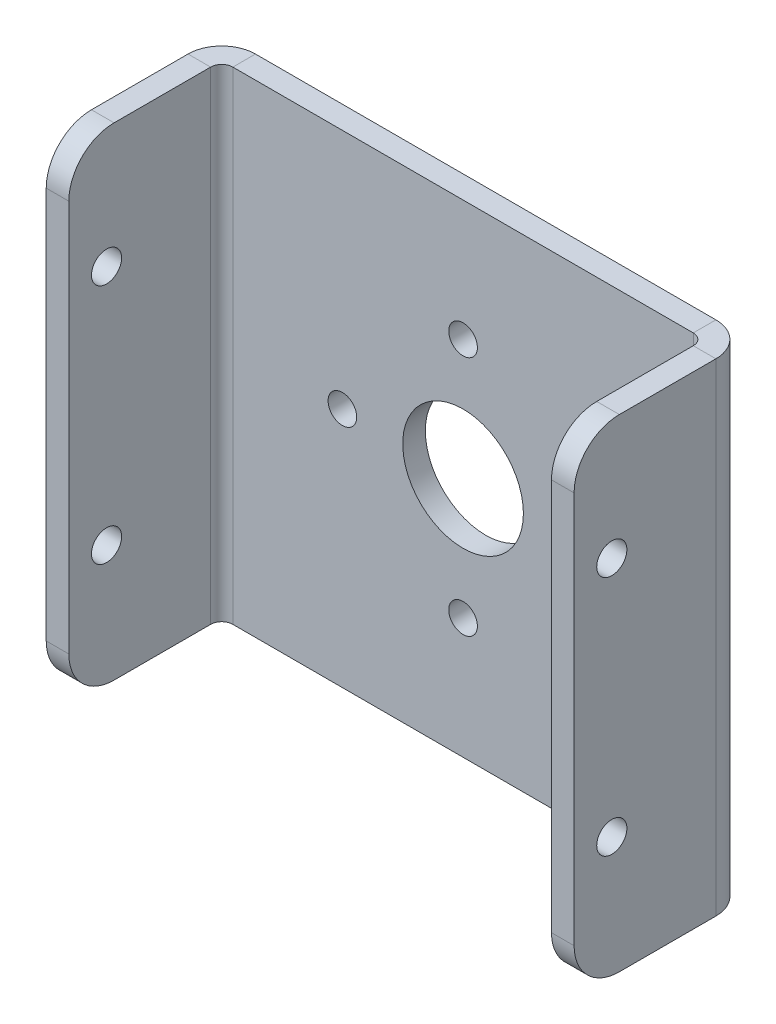
from build123d import *

# Parameters (mm, degrees)
SM_BASE_FLANGE_1_DEPTH = 1.5
OTHER_START            = -16
OTHER_1_DEPTH          = 32
OTHER_1_2_DEPTH        = 32
OTHER_START_2          = -18
OTHER_1_3_DEPTH        = 36
SKETCH_7_R             = 1
CUT_EXTRUDE_1_DEPTH    = 40.796735326
SKETCH_8_R             = 4
SKETCH_8_R_2           = 0.95
CUT_EXTRUDE_2_DEPTH    = 10


with BuildPart() as part:
    # 基体-法兰1: sheet metal written as solids
    # Sketch 1 → 基体-法兰1 (new body)
    with BuildSketch(Plane.XY):
        with BuildLine():
            Line((-24, -16), (24, -16))
            ThreePointArc((24, -16), (26.121320344, -15.121320344), (27, -13))
            Line((27, -13), (27, 13))
            ThreePointArc((27, 13), (26.121320344, 15.121320344), (24, 16))
            Line((24, 16), (-24, 16))
            ThreePointArc((-24, 16), (-26.121320344, 15.121320344), (-27, 13))
            Line((-27, 13), (-27, -13))
            ThreePointArc((-27, -13), (-26.121320344, -15.121320344), (-24, -16))
        make_face()
    extrude(amount=-SM_BASE_FLANGE_1_DEPTH)

    # Other 1: read off the stored shape, not the designer's step
    # Other 1 outline → Other 1 (cut)
    with BuildSketch(Plane(origin=(0, 0, 0), x_dir=(1, 0, 0), z_dir=(0, 1, 0)).offset(OTHER_START)):
        with BuildLine():
            ThreePointArc((-17.375223856, 0), (-16.558564082, 1.086838938), (-15.2634, 1.5))
            Line((-15.2634, 1.5), (-27, 1.5))
            Line((-27, 1.5), (-27, 0))
            Line((-27, 0), (-17.375223856, 0))
        make_face()
        with BuildLine():
            Line((27, 1.5), (15.2634, 1.5))
            ThreePointArc((15.2634, 1.5), (16.558564082, 1.086838938), (17.375223856, 0))
            Line((17.375223856, 0), (27, 0))
            Line((27, 0), (27, 1.5))
        make_face()
    extrude(amount=OTHER_1_DEPTH, mode=Mode.SUBTRACT)

    # Other 1 2 outline → Other 1 2 (add)
    with BuildSketch(Plane(origin=(0, 0, 0), x_dir=(1, 0, 0), z_dir=(0, 1, 0)).offset(OTHER_START)):
        with BuildLine():
            Line((-15.2634, 0), (-17.375223856, 0))
            ThreePointArc((-17.375223856, 0), (-17.468585343, -0.363053267), (-17.5, -0.7366))
            Line((-17.5, -0.7366), (-17.5, -10.138054181))
            Line((-17.5, -10.138054181), (-16, -10.138054181))
            Line((-16, -10.138054181), (-16, -0.7366))
            ThreePointArc((-16, -0.7366), (-15.784254855, -0.215745145), (-15.2634, 0))
        make_face()
        with BuildLine():
            ThreePointArc((17.5, -0.7366), (17.468585343, -0.363053267), (17.375223856, 0))
            Line((17.375223856, 0), (15.2634, 0))
            ThreePointArc((15.2634, 0), (15.784254855, -0.215745145), (16, -0.7366))
            Line((16, -0.7366), (16, -10.138054181))
            Line((16, -10.138054181), (17.5, -10.138054181))
            Line((17.5, -10.138054181), (17.5, -0.7366))
        make_face()
    extrude(amount=OTHER_1_2_DEPTH)

    # Other 1 3 outline → Other 1 3 (cut)
    with BuildSketch(Plane.YZ.offset(OTHER_START_2)):
        with BuildLine():
            ThreePointArc((-16, 7.138054181), (-15.121320344, 9.259374525), (-13, 10.138054181))
            Line((-13, 10.138054181), (-16, 10.138054181))
            Line((-16, 10.138054181), (-16, 7.138054181))
        make_face()
        with BuildLine():
            ThreePointArc((13, 10.138054181), (15.121320344, 9.259374525), (16, 7.138054181))
            Line((16, 7.138054181), (16, 10.138054181))
            Line((16, 10.138054181), (13, 10.138054181))
        make_face()
    extrude(amount=OTHER_1_3_DEPTH, mode=Mode.SUBTRACT)

    # 草图7 → 切除-拉伸1 (cut, through all)
    with BuildSketch(Plane.ZY.offset(17.5)):
        with Locations((7.638054181, 8)):
            Circle(SKETCH_7_R)
        with Locations((7.638054181, -8)):
            Circle(SKETCH_7_R)
    extrude(amount=-CUT_EXTRUDE_1_DEPTH, mode=Mode.SUBTRACT)

    # 草图8 → 切除-拉伸2 (cut)
    with BuildSketch(Plane.XY):
        Circle(SKETCH_8_R)
        with Locations((0, 8)):
            Circle(SKETCH_8_R_2)
        with Locations((8, 0)):
            Circle(SKETCH_8_R_2)
        with Locations((0, -8)):
            Circle(SKETCH_8_R_2)
        with Locations((-8, 0)):
            Circle(SKETCH_8_R_2)
    extrude(amount=-CUT_EXTRUDE_2_DEPTH, mode=Mode.SUBTRACT)


solid = part.part
